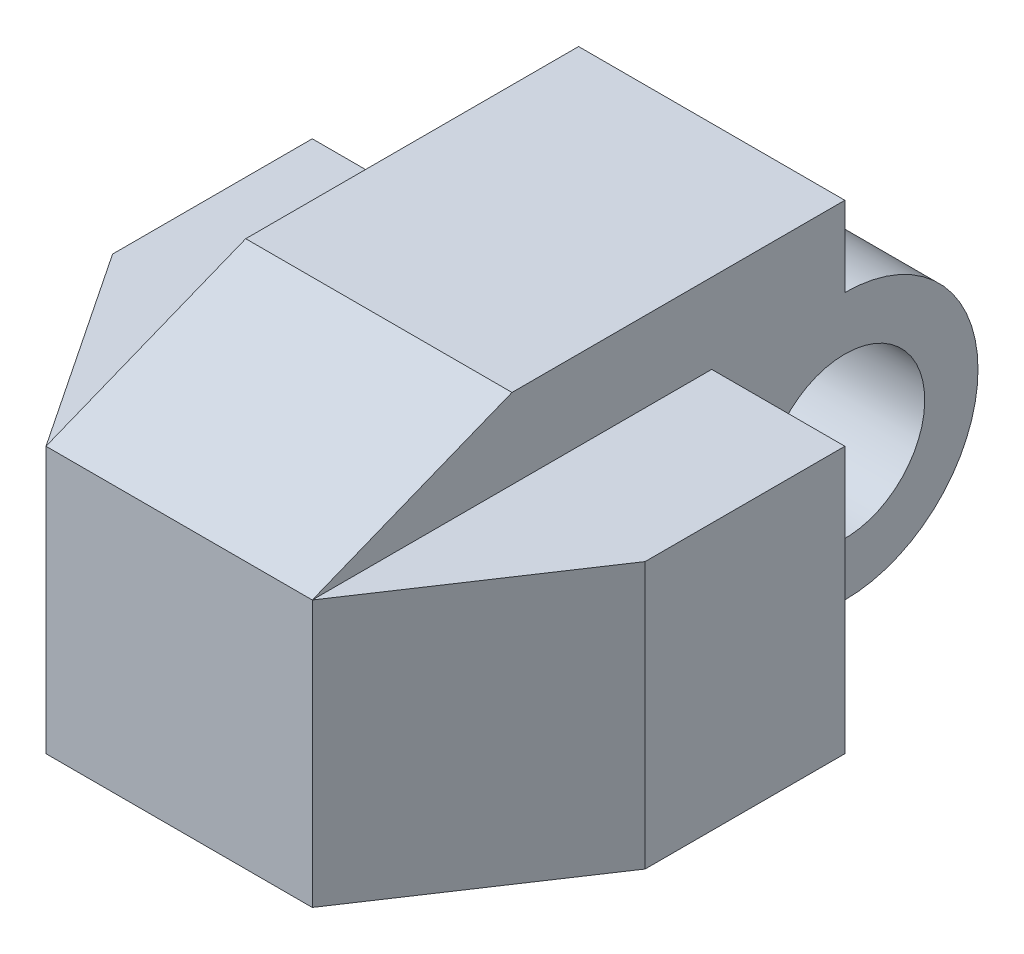
from build123d import *

# Parameters (mm, degrees)
SKETCH1_W           = 10
SKETCH1_H           = 10
BOSS_EXTRUDE1_DEPTH = 10
SKETCH2_R           = 3
CUT_EXTRUDE1_DEPTH  = 10
FILLET2_R           = 5
SKETCH3_W           = 20
SKETCH3_H           = 10
BOSS_EXTRUDE3_DEPTH = 15
CUT_EXTRUDE2_DEPTH  = 15
SKETCH5_W           = 10
SKETCH5_H           = 20
BOSS_EXTRUDE4_DEPTH = 3
CUT_EXTRUDE3_DEPTH  = 10


with BuildPart() as part:
    # Sketch1 → Boss-Extrude1 (new body)
    with BuildSketch(Plane.XY):
        with Locations((1.321243523, -0.103626943)):
            Rectangle(SKETCH1_W, SKETCH1_H)
    extrude(amount=BOSS_EXTRUDE1_DEPTH)

    # Sketch2 → Cut-Extrude1 (cut)
    with BuildSketch(Plane(origin=(6.321243523, 0, 0), x_dir=(0, 0, -1), z_dir=(1, 0, 0))):
        with Locations(Location((-5, -0.103626943, 0), (0, 0, 90))):
            Circle(SKETCH2_R)
    extrude(amount=-CUT_EXTRUDE1_DEPTH, mode=Mode.SUBTRACT)

    # Fillet2
    fillet2_edges = [part.edges().sort_by_distance(p)[0] for p in [
        (1.321243523, -5.103626943, 0),
        (1.321243523, 4.896373057, 0),
    ]]
    fillet(fillet2_edges, radius=FILLET2_R - 0.0001)  # a hair under: the kernel refuses the full size

    # Sketch3 → Boss-Extrude3 (add)
    with BuildSketch(Plane.XY.offset(10)):
        with Locations((1.321243523, -0.103626943)):
            Rectangle(SKETCH3_W, SKETCH3_H)
    extrude(amount=BOSS_EXTRUDE3_DEPTH)

    # Sketch4 → Cut-Extrude2 (cut)
    with BuildSketch(Plane(origin=(0, 4.896373057, 0), x_dir=(1, 0, 0), z_dir=(0, 1, 0))):
        Polygon((11.321243523, -17.5), (6.321243523, -25), (11.321243523, -25), align=None)
        Polygon((-8.678756477, -25), (-3.678756477, -25), (-8.678756477, -17.5), align=None)
    extrude(amount=-CUT_EXTRUDE2_DEPTH, mode=Mode.SUBTRACT)

    # Sketch5 → Boss-Extrude4 (add)
    with BuildSketch(Plane(origin=(0, 4.896373057, 0), x_dir=(1, 0, 0), z_dir=(0, 1, 0))):
        with Locations((1.321243523, -15)):
            Rectangle(SKETCH5_W, SKETCH5_H)
    extrude(amount=BOSS_EXTRUDE4_DEPTH)

    # Sketch6 → Cut-Extrude3 (cut)
    with BuildSketch(Plane.ZY.offset(3.678756477)):
        Polygon((17.5, 7.896373057), (25, 4.896373057), (25, 7.896373057), align=None)
    extrude(amount=-CUT_EXTRUDE3_DEPTH, mode=Mode.SUBTRACT)


solid = part.part
